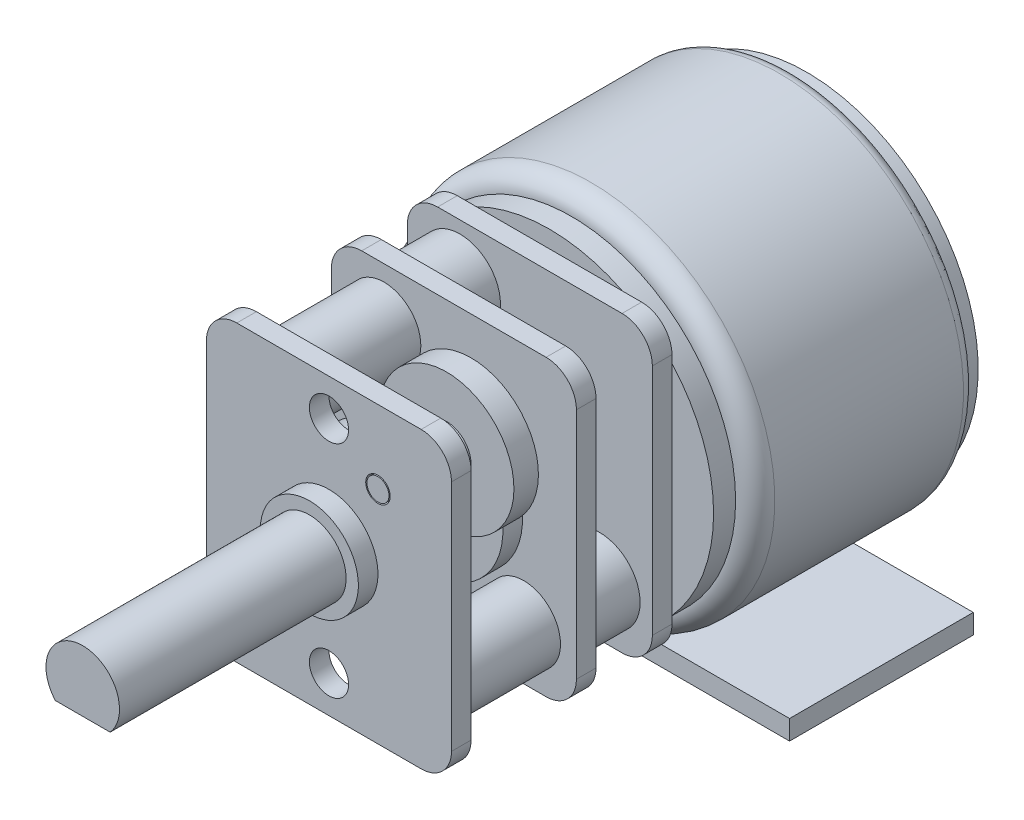
from build123d import *

# Parameters (mm, degrees)
SKETCH_2_OUTSIDE_W           = 24.52
SKETCH_2_OUTSIDE_H           = 24.52
CUT_EXTRUDE_1539_DEPTH       = 6.5
EXTRUDE_5_DEPTH              = 0.8
EXTRUDE_START                = 0.8
SKETCH_8_R                   = 0.8
SKETCH_8_R_2                 = 0.5
EXTRUDE_6_DEPTH              = 0.8
SKETCH_9_R                   = 1.65
EXTRUDE_7_DEPTH              = 2.3
EXTRUDE_8_DEPTH              = 0.8
EXTRUDE_9_REACH              = 21.113
SKETCH_11_R                  = 1.5
SKETCH_4_W                   = 11.5
SKETCH_4_H                   = 7.5
EXTRUDE_4966_DEPTH           = 0.8
SKETCH_5005_R                = 0.75
EXTRUDE_5453_DEPTH           = 0.7
EXTRUDE_5453_DRAFT           = 35
EXTRUDE_5453_PROFILE_2_DEPTH = 0.7
EXTRUDE_5453_PROFILE_2_DRAFT = 35
EXTRUDE_5453_PROFILE_3_DEPTH = 0.7
EXTRUDE_5453_PROFILE_3_DRAFT = 35
EXTRUDE_5453_PROFILE_4_DEPTH = 0.7
EXTRUDE_5453_PROFILE_4_DRAFT = 35
EXTRUDE_5453_PROFILE_5_DEPTH = 0.7
EXTRUDE_5453_PROFILE_5_DRAFT = 35
EXTRUDE_5453_PROFILE_6_DEPTH = 0.7
EXTRUDE_5453_PROFILE_6_DRAFT = 35
EXTRUDE_5453_PROFILE_7_DEPTH = 0.7
EXTRUDE_5453_PROFILE_7_DRAFT = 35
EXTRUDE_5453_PROFILE_8_DEPTH = 0.7
EXTRUDE_5453_PROFILE_8_DRAFT = 35
EXTRUDE_5762_DEPTH           = 0.01


with BuildPart() as part:
    # Эскиз1 → Motor (revolve)
    with BuildSketch(Plane(origin=(0, 0, 0), x_dir=(1, 0, 0), z_dir=(0, 1, 0))):
        with BuildLine():
            Line((0, 0), (-0.5, 0))
            ThreePointArc((-0.5, 0), (-0.676776695, -0.073223305), (-0.75, -0.25))
            Line((-0.75, -0.25), (-0.75, -0.5))
            Line((-0.75, -0.5), (-3, -0.5))
            Line((-3, -0.5), (-3, -1.5))
            Line((-3, -1.5), (-7, -1.5))
            Line((-7, -1.5), (-7, -2.1))
            ThreePointArc((-7, -2.1), (-7.353553391, -2.246446609), (-7.5, -2.6))
            Line((-7.5, -2.6), (-7.5, -10.3))
            ThreePointArc((-7.5, -10.3), (-7.265685425, -10.865685425), (-6.7, -11.1))
            Line((-6.7, -11.1), (-6.7, -12))
            Line((-6.7, -12), (-0.75, -12))
            Line((-0.75, -12), (0, -12))
            Line((0, -12), (0, 0))
        make_face()
        Polygon((0, -21), (-2, -21), (-2, -21.8), (-1.5, -21.8), (-1.5, -31.05), (0, -31.05), align=None)
    revolve(axis=Axis((0, 0, 0), (0, 0, 1)))

    # Эскиз2 outside → Cut-Extrude 1539 (cut)
    with BuildSketch(Plane.XY.offset(31.05)):
        Rectangle(SKETCH_2_OUTSIDE_W, SKETCH_2_OUTSIDE_H)
        with BuildLine():
            Line((-1.118033989, -1), (1.118033989, -1))
            ThreePointArc((1.118033989, -1), (0, 1.5), (-1.118033989, -1))
        make_face(mode=Mode.SUBTRACT)
    extrude(amount=-CUT_EXTRUDE_1539_DEPTH, mode=Mode.SUBTRACT)

    # Эскиз7 → Бобышка-Вытянуть5 (add)
    with BuildSketch(Plane.XY.offset(12)):
        with BuildLine():
            Line((3.762711015, 6), (-3.762711015, 6))
            ThreePointArc((-3.762711015, 6), (-4.637606447, 5.637606447), (-5, 4.762711015))
            Line((-5, 4.762711015), (-5, -4.762711015))
            ThreePointArc((-5, -4.762711015), (-4.637606447, -5.637606447), (-3.762711015, -6))
            Line((-3.762711015, -6), (3.762711015, -6))
            ThreePointArc((3.762711015, -6), (4.637606447, -5.637606447), (5, -4.762711015))
            Line((5, -4.762711015), (5, 4.762711015))
            ThreePointArc((5, 4.762711015), (4.637606447, 5.637606447), (3.762711015, 6))
        make_face()
    extrude(amount=EXTRUDE_5_DEPTH)

    # Эскиз8 → Бобышка-Вытянуть6 (add)
    with BuildSketch(Plane(origin=(0, 0, 21), x_dir=(-1, 0, 0), z_dir=(0, 0, -1)).offset(EXTRUDE_START)):
        with BuildLine():
            Line((3.762711015, 6), (-3.762711015, 6))
            ThreePointArc((-3.762711015, 6), (-4.637606447, 5.637606447), (-5, 4.762711015))
            Line((-5, 4.762711015), (-5, -4.762711015))
            ThreePointArc((-5, -4.762711015), (-4.637606447, -5.637606447), (-3.762711015, -6))
            Line((-3.762711015, -6), (3.762711015, -6))
            ThreePointArc((3.762711015, -6), (4.637606447, -5.637606447), (5, -4.762711015))
            Line((5, -4.762711015), (5, 4.762711015))
            ThreePointArc((5, 4.762711015), (4.637606447, 5.637606447), (3.762711015, 6))
        make_face()
        with Locations((0, -4.5)):
            Circle(SKETCH_8_R, mode=Mode.SUBTRACT)
        with Locations((0, 4.5)):
            Circle(SKETCH_8_R, mode=Mode.SUBTRACT)
        with Locations((2, -3)):
            Circle(SKETCH_8_R_2, mode=Mode.SUBTRACT)
        with Locations((-2, 3)):
            Circle(SKETCH_8_R_2, mode=Mode.SUBTRACT)
    extrude(amount=-EXTRUDE_6_DEPTH)

    # Эскиз9 → Бобышка-Вытянуть7 (add)
    with BuildSketch(Plane.XY.offset(12.8)):
        with Locations((2.85, -3.85)):
            Circle(SKETCH_9_R)
        with Locations((-2.85, 3.85)):
            Circle(SKETCH_9_R)
    extrude(amount=EXTRUDE_7_DEPTH)

    # Эскиз10 → Бобышка-Вытянуть8 (add)
    with BuildSketch(Plane.XY.offset(15.1)):
        with BuildLine():
            Line((3.762711015, 6), (-3.762711015, 6))
            ThreePointArc((-3.762711015, 6), (-4.637606447, 5.637606447), (-5, 4.762711015))
            Line((-5, 4.762711015), (-5, -0.262711015))
            ThreePointArc((-5, -0.262711015), (-4.637606447, -1.137606447), (-3.762711015, -1.5))
            Line((-3.762711015, -1.5), (-1.237288985, -1.5))
            ThreePointArc((-1.237288985, -1.5), (-0.362393553, -1.862393553), (0, -2.737288985))
            Line((0, -2.737288985), (0, -4.762711015))
            ThreePointArc((0, -4.762711015), (0.362393553, -5.637606447), (1.237288985, -6))
            Line((1.237288985, -6), (3.762711015, -6))
            ThreePointArc((3.762711015, -6), (4.637606447, -5.637606447), (5, -4.762711015))
            Line((5, -4.762711015), (5, 4.762711015))
            ThreePointArc((5, 4.762711015), (4.637606447, 5.637606447), (3.762711015, 6))
        make_face()
    extrude(amount=EXTRUDE_8_DEPTH)

    # Эскиз11 → Бобышка-Вытянуть9 (add, up to next)
    with BuildSketch(Plane.XY.offset(15.9), mode=Mode.PRIVATE) as extrude_9_sk1:
        with Locations((2.85, -3.85)):
            Circle(SKETCH_11_R)
    extrude_9_tool1 = extrude(extrude_9_sk1.sketch, amount=EXTRUDE_9_REACH, mode=Mode.PRIVATE) - part.part
    # Эскиз11 → Бобышка-Вытянуть9 (add, up to next)
    with BuildSketch(Plane.XY.offset(15.9), mode=Mode.PRIVATE) as extrude_9_sk2:
        with Locations((-2.85, 3.85)):
            Circle(SKETCH_11_R)
    extrude_9_tool2 = extrude(extrude_9_sk2.sketch, amount=EXTRUDE_9_REACH, mode=Mode.PRIVATE) - part.part
    add(extrude_9_tool1.solids().sort_by_distance((2.85, -3.85, 15.9))[0])
    add(extrude_9_tool2.solids().sort_by_distance((-2.85, 3.85, 15.9))[0])

    # Эскиз12 → Повернуть1 (revolve)
    with BuildSketch(Plane(origin=(0, 0, 0), x_dir=(1, 0, 0), z_dir=(0, 1, 0))):
        Polygon((0, -20.2), (-0.5, -20.2), (-0.5, -20), (-3, -20), (-3, -18.6), (-0.5, -18.6), (-0.5, -18.3), (-1.5, -18.3), (-1.5, -16.9), (-3, -16.9), (-3, -16.1), (-0.5, -16.1), (-0.5, -15.9), (0, -15.9), align=None)
        with BuildLine():
            Line((0, -12.8), (-0.75, -12.8))
            Line((-0.75, -12.8), (-0.75, -13))
            Line((-0.75, -13), (-1.5, -13))
            Line((-1.5, -13), (-1.5, -14))
            Line((-1.5, -14), (-0.75, -14))
            Line((-0.75, -14), (-0.75, -14.15))
            ThreePointArc((-0.75, -14.15), (-0.676776695, -14.326776695), (-0.5, -14.4))
            Line((-0.5, -14.4), (0, -14.4))
            Line((0, -14.4), (0, -12.8))
        make_face()
    revolve(axis=Axis((0, 0, 20.2), (0, 0, -1)))

    # Эскиз13 → Повернуть2 (revolve)
    with BuildSketch(Plane(origin=(0, 0, 0), x_dir=(0, 0, 1), z_dir=(-0.8320502943378438, 0.5547001962252291, 0))):
        Polygon((21, -3.605551275), (12.8, -3.605551275), (12.8, -3.304954271), (13, -3.304954271), (13, -0.855551275), (14, -0.855551275), (14, -2.605551275), (17.3, -2.605551275), (17.3, -3.155551275), (21, -3.155551275), align=None)
    revolve(axis=Axis((-2, -3, 21), (0, 0, 1)))

    # Эскиз14 → Повернуть3 (revolve)
    with BuildSketch(Plane(origin=(0, 0, 0), x_dir=(0, 0, 1), z_dir=(-0.8320502943378438, 0.5547001962252291, 0))):
        Polygon((21, 3.605551275), (15.9, 3.605551275), (15.9, 3.105551275), (17.2, 3.105551275), (17.2, 0.855551275), (18.2, 0.855551275), (18.2, 2.605551275), (20, 2.605551275), (20, 3.155551275), (21, 3.155551275), align=None)
    revolve(axis=Axis((2, 3, 21), (0, 0, 1)))


with BuildPart() as body_2:
    # Эскиз4 → Extrude 4966 (new body)
    with BuildSketch(Plane(origin=(0, -7.5, 0), x_dir=(-1, 0, 0), z_dir=(0, -1, 0))):
        with Locations((-2.25, -6.45)):
            Rectangle(SKETCH_4_W, SKETCH_4_H)
    extrude(amount=EXTRUDE_4966_DEPTH)


with BuildPart() as extrude_5453_tool:
    # Sketch 5005 → Extrude 5453 (with draft: the straight prism first)
    with BuildSketch(Plane.XZ.offset(8.3)):
        with Locations((-2.25, 5.7)):
            Circle(SKETCH_5005_R)
    extrude(amount=EXTRUDE_5453_DEPTH)
    # Extrude 5453: the draft: its side faces are tilted about the plane it starts from
    extrude_5453_sides = [extrude_5453_tool.faces().sort_by_distance(p)[0] for p in [
        (-3, -8.65, 5.7),
    ]]
    draft(extrude_5453_sides, Plane.XZ.offset(8.3), EXTRUDE_5453_DRAFT)


with BuildPart() as body_2_1:
    add(body_2.part)

    # Extrude 5453: add extrude_5453_tool
    add(extrude_5453_tool.part)


with BuildPart() as extrude_5453_profile_2_tool:
    # Sketch 5005 → Extrude 5453 profile 2 (with draft: the straight prism first)
    with BuildSketch(Plane.XZ.offset(8.3)):
        with Locations((-0.75, 7.2)):
            Circle(SKETCH_5005_R)
    extrude(amount=EXTRUDE_5453_PROFILE_2_DEPTH)
    # Extrude 5453 profile 2: the draft: its side faces are tilted about the plane it starts from
    extrude_5453_profile_2_sides = [extrude_5453_profile_2_tool.faces().sort_by_distance(p)[0] for p in [
        (-1.5, -8.65, 7.2),
    ]]
    draft(extrude_5453_profile_2_sides, Plane.XZ.offset(8.3), EXTRUDE_5453_PROFILE_2_DRAFT)


with BuildPart() as body_2_2:
    add(body_2_1.part)

    # Extrude 5453 profile 2: add extrude_5453_profile_2_tool
    add(extrude_5453_profile_2_tool.part)


with BuildPart() as extrude_5453_profile_3_tool:
    # Sketch 5005 → Extrude 5453 profile 3 (with draft: the straight prism first)
    with BuildSketch(Plane.XZ.offset(8.3)):
        with Locations((0.75, 5.7)):
            Circle(SKETCH_5005_R)
    extrude(amount=EXTRUDE_5453_PROFILE_3_DEPTH)
    # Extrude 5453 profile 3: the draft: its side faces are tilted about the plane it starts from
    extrude_5453_profile_3_sides = [extrude_5453_profile_3_tool.faces().sort_by_distance(p)[0] for p in [
        (0, -8.65, 5.7),
    ]]
    draft(extrude_5453_profile_3_sides, Plane.XZ.offset(8.3), EXTRUDE_5453_PROFILE_3_DRAFT)


with BuildPart() as body_2_3:
    add(body_2_2.part)

    # Extrude 5453 profile 3: add extrude_5453_profile_3_tool
    add(extrude_5453_profile_3_tool.part)


with BuildPart() as extrude_5453_profile_4_tool:
    # Sketch 5005 → Extrude 5453 profile 4 (with draft: the straight prism first)
    with BuildSketch(Plane.XZ.offset(8.3)):
        with Locations((2.25, 7.2)):
            Circle(SKETCH_5005_R)
    extrude(amount=EXTRUDE_5453_PROFILE_4_DEPTH)
    # Extrude 5453 profile 4: the draft: its side faces are tilted about the plane it starts from
    extrude_5453_profile_4_sides = [extrude_5453_profile_4_tool.faces().sort_by_distance(p)[0] for p in [
        (1.5, -8.65, 7.2),
    ]]
    draft(extrude_5453_profile_4_sides, Plane.XZ.offset(8.3), EXTRUDE_5453_PROFILE_4_DRAFT)


with BuildPart() as body_2_4:
    add(body_2_3.part)

    # Extrude 5453 profile 4: add extrude_5453_profile_4_tool
    add(extrude_5453_profile_4_tool.part)


with BuildPart() as extrude_5453_profile_5_tool:
    # Sketch 5005 → Extrude 5453 profile 5 (with draft: the straight prism first)
    with BuildSketch(Plane.XZ.offset(8.3)):
        with Locations((7, 3.7)):
            Circle(SKETCH_5005_R)
    extrude(amount=EXTRUDE_5453_PROFILE_5_DEPTH)
    # Extrude 5453 profile 5: the draft: its side faces are tilted about the plane it starts from
    extrude_5453_profile_5_sides = [extrude_5453_profile_5_tool.faces().sort_by_distance(p)[0] for p in [
        (6.25, -8.65, 3.7),
    ]]
    draft(extrude_5453_profile_5_sides, Plane.XZ.offset(8.3), EXTRUDE_5453_PROFILE_5_DRAFT)


with BuildPart() as body_2_5:
    add(body_2_4.part)

    # Extrude 5453 profile 5: add extrude_5453_profile_5_tool
    add(extrude_5453_profile_5_tool.part)


with BuildPart() as extrude_5453_profile_6_tool:
    # Sketch 5005 → Extrude 5453 profile 6 (with draft: the straight prism first)
    with BuildSketch(Plane.XZ.offset(8.3)):
        with Locations((7, 5.533333333)):
            Circle(SKETCH_5005_R)
    extrude(amount=EXTRUDE_5453_PROFILE_6_DEPTH)
    # Extrude 5453 profile 6: the draft: its side faces are tilted about the plane it starts from
    extrude_5453_profile_6_sides = [extrude_5453_profile_6_tool.faces().sort_by_distance(p)[0] for p in [
        (6.25, -8.65, 5.533333333),
    ]]
    draft(extrude_5453_profile_6_sides, Plane.XZ.offset(8.3), EXTRUDE_5453_PROFILE_6_DRAFT)


with BuildPart() as body_2_6:
    add(body_2_5.part)

    # Extrude 5453 profile 6: add extrude_5453_profile_6_tool
    add(extrude_5453_profile_6_tool.part)


with BuildPart() as extrude_5453_profile_7_tool:
    # Sketch 5005 → Extrude 5453 profile 7 (with draft: the straight prism first)
    with BuildSketch(Plane.XZ.offset(8.3)):
        with Locations((7, 7.366666667)):
            Circle(SKETCH_5005_R)
    extrude(amount=EXTRUDE_5453_PROFILE_7_DEPTH)
    # Extrude 5453 profile 7: the draft: its side faces are tilted about the plane it starts from
    extrude_5453_profile_7_sides = [extrude_5453_profile_7_tool.faces().sort_by_distance(p)[0] for p in [
        (6.25, -8.65, 7.366666667),
    ]]
    draft(extrude_5453_profile_7_sides, Plane.XZ.offset(8.3), EXTRUDE_5453_PROFILE_7_DRAFT)


with BuildPart() as body_2_7:
    add(body_2_6.part)

    # Extrude 5453 profile 7: add extrude_5453_profile_7_tool
    add(extrude_5453_profile_7_tool.part)


with BuildPart() as extrude_5453_profile_8_tool:
    # Sketch 5005 → Extrude 5453 profile 8 (with draft: the straight prism first)
    with BuildSketch(Plane.XZ.offset(8.3)):
        with Locations((7, 9.2)):
            Circle(SKETCH_5005_R)
    extrude(amount=EXTRUDE_5453_PROFILE_8_DEPTH)
    # Extrude 5453 profile 8: the draft: its side faces are tilted about the plane it starts from
    extrude_5453_profile_8_sides = [extrude_5453_profile_8_tool.faces().sort_by_distance(p)[0] for p in [
        (6.25, -8.65, 9.2),
    ]]
    draft(extrude_5453_profile_8_sides, Plane.XZ.offset(8.3), EXTRUDE_5453_PROFILE_8_DRAFT)


with BuildPart() as body_2_8:
    add(body_2_7.part)

    # Extrude 5453 profile 8: add extrude_5453_profile_8_tool
    add(extrude_5453_profile_8_tool.part)

    # Эскиз6 → Extrude 5762 (add)
    # profile 1 of 16: a face of its own
    with BuildSketch(Plane.XZ.offset(8.3)):
        with BuildLine():
            Line((5.183226347, 9.305128205), (5.183226347, 9.228846154))
            add(Edge.make_bspline(
                [(5.183226347, 9.228846154), (5.173106274, 9.22934332), (5.153230721, 9.23031974), (5.124252058, 9.234892324), (5.096553035, 9.241435109), (5.070356056, 9.250685891), (5.045429488, 9.262174558), (5.021872342, 9.27595185), (4.999774482, 9.292270357), (4.979340763, 9.310777707), (4.96059521, 9.330878662), (4.944407508, 9.352567247), (4.930730359, 9.375358182), (4.919296343, 9.399182322), (4.910713809, 9.424308459), (4.904345697, 9.450508582), (4.900514298, 9.4778978), (4.900102465, 9.496558949), (4.899893013, 9.506049679)],
                knots=[0, 0, 0, 0, 1.10065271, 2.161652631, 3.183658789, 4.190468796, 5.17591951, 6.163126047, 7.15150782, 8.156236427, 9.156009102, 10.134482811, 11.092018607, 12.041330605, 13.001268258, 13.972401359, 14.968799086, 16, 16, 16, 16], degree=3))
            add(Edge.make_bspline(
                [(4.899893013, 9.506049679), (4.900109439, 9.515370725), (4.900534708, 9.533686246), (4.904241722, 9.560406313), (4.909922389, 9.585903666), (4.918340243, 9.609889343), (4.928902809, 9.632609504), (4.942038744, 9.653782836), (4.957126498, 9.673921332), (4.974923245, 9.69203663), (4.993912419, 9.708677717), (5.014192696, 9.723021328), (5.035163128, 9.735374158), (5.056987523, 9.745484564), (5.079736952, 9.753148701), (5.10319331, 9.758827092), (5.127627297, 9.762073168), (5.144167936, 9.762568621), (5.152577308, 9.762820513)],
                knots=[0, 0, 0, 0, 1.111674182, 2.184400057, 3.212814286, 4.223731311, 5.211378316, 6.196328225, 7.191884489, 8.207283132, 9.220262353, 10.201199469, 11.166417575, 12.120932471, 13.06540007, 14.026332106, 14.996573967, 16, 16, 16, 16], degree=3))
            add(Edge.make_bspline(
                [(5.152577308, 9.762820513), (5.164416063, 9.762409285), (5.187885819, 9.761594047), (5.222375218, 9.75462065), (5.255790478, 9.743728994), (5.282684739, 9.730616512), (5.304353679, 9.717384889), (5.322203622, 9.705473201), (5.341418154, 9.691449296), (5.362075046, 9.675432988), (5.383903778, 9.657148454), (5.407349714, 9.637070722), (5.431979324, 9.614681279), (5.448812639, 9.598980897), (5.457535241, 9.590845353)],
                knots=[0, 0, 0, 0, 1.184416499, 2.348048165, 3.509039915, 4.696071444, 5.333504901, 6.05069495, 6.844171097, 7.714965912, 8.667477798, 9.695072654, 10.805644396, 12, 12, 12, 12], degree=3))
            Line((5.457535241, 9.590845353), (5.684508398, 9.37817508))
            Line((5.684508398, 9.37817508), (5.684508398, 9.773717949))
            Line((5.684508398, 9.773717949), (5.771687885, 9.773717949))
            Line((5.771687885, 9.773717949), (5.771687885, 9.196153846))
            Line((5.771687885, 9.196153846), (5.419905033, 9.525801282))
            add(Edge.make_bspline(
                [(5.419905033, 9.525801282), (5.411526873, 9.533827197), (5.395434141, 9.549243338), (5.371939423, 9.571047678), (5.350143106, 9.590631433), (5.330086372, 9.608121371), (5.311475849, 9.623138079), (5.294914278, 9.636464193), (5.279673911, 9.647141551), (5.262008334, 9.658729575), (5.240439628, 9.669952971), (5.214081446, 9.6795974), (5.186947685, 9.685478149), (5.168611476, 9.686183609), (5.159388206, 9.686538462)],
                knots=[0, 0, 0, 0, 1.329631726, 2.553950428, 3.673215718, 4.687767853, 5.603093632, 6.413772471, 7.123043292, 7.734684054, 8.834405432, 9.900288307, 10.943827018, 12, 12, 12, 12], degree=3))
            add(Edge.make_bspline(
                [(5.159388206, 9.686538462), (5.153588438, 9.686384067), (5.142158208, 9.686079785), (5.125399667, 9.683394344), (5.109233926, 9.679336078), (5.093611262, 9.673520801), (5.078688746, 9.665844879), (5.064448215, 9.656501344), (5.050680895, 9.6457209), (5.037772237, 9.633249877), (5.025949658, 9.619549937), (5.015476666, 9.605077047), (5.006724311, 9.589764879), (4.999549462, 9.573677992), (4.993921155, 9.556861236), (4.990021214, 9.539282083), (4.987572611, 9.520989108), (4.987241312, 9.508498116), (4.987072501, 9.502133413)],
                knots=[0, 0, 0, 0, 0.991446411, 1.95395049, 2.89581595, 3.838931463, 4.798493298, 5.75982156, 6.748411868, 7.785213223, 8.824556874, 9.840280684, 10.836137867, 11.835679398, 12.848801643, 13.863922112, 14.911575587, 16, 16, 16, 16], degree=3))
            add(Edge.make_bspline(
                [(4.987072501, 9.502133413), (4.987239299, 9.495484543), (4.987566864, 9.482427259), (4.990048006, 9.463296967), (4.993809418, 9.444921487), (4.999783361, 9.427574998), (5.006841872, 9.410881872), (5.015808949, 9.395198482), (5.026228891, 9.380264435), (5.03831124, 9.366325367), (5.051886632, 9.353594562), (5.066847651, 9.342251598), (5.08308659, 9.332405907), (5.1005368, 9.323803635), (5.119372022, 9.316820921), (5.139521114, 9.311484355), (5.160897794, 9.307261899), (5.175659878, 9.305851249), (5.183226347, 9.305128205)],
                knots=[0, 0, 0, 0, 1.030878251, 2.024474673, 2.987898669, 3.934362936, 4.864849709, 5.795128259, 6.730474222, 7.685293701, 8.650606017, 9.611896181, 10.591709709, 11.591680886, 12.625074257, 13.701333388, 14.821793024, 16, 16, 16, 16], degree=3))
        make_face()
    # profile 2 of 16: a face of its own
    with BuildSketch(Plane.XZ.offset(8.3)):
        Polygon((4.921687885, 8.749358974), (5.771687885, 9.141666667), (5.771687885, 9.05874399), (5.499251988, 8.933082933), (5.499251988, 8.54775641), (5.771687885, 8.418519631), (5.771687885, 8.33525641), (4.921687885, 8.738461538), align=None)
        Polygon((5.087362965, 8.743058894), (5.412072501, 8.589132612), (5.412072501, 8.892898638), align=None, mode=Mode.SUBTRACT)
    # profile 3 of 16: a face of its own
    with BuildSketch(Plane.XZ.offset(8.3)):
        Polygon((4.921687885, 7.524248798), (4.921687885, 7.681410256), (5.771687885, 7.681410256), (5.771687885, 7.605128205), (5.008867372, 7.605128205), (5.008867372, 7.474358974), align=None)
    # profile 4 of 16: a face of its own
    with BuildSketch(Plane.XZ.offset(8.3)):
        Polygon((4.921687885, 6.896794872), (5.771687885, 7.289102564), (5.771687885, 7.206179888), (5.499251988, 7.08051883), (5.499251988, 6.695192308), (5.771687885, 6.565955529), (5.771687885, 6.482692308), (4.921687885, 6.885897436), align=None)
        Polygon((5.087362965, 6.890494792), (5.412072501, 6.73656851), (5.412072501, 7.040334535), align=None, mode=Mode.SUBTRACT)
    # profile 5 of 16: a face of its own
    with BuildSketch(Plane.XZ.offset(8.3)):
        with BuildLine():
            Line((5.183226347, 5.6), (5.183226347, 5.523717949))
            add(Edge.make_bspline(
                [(5.183226347, 5.523717949), (5.173106274, 5.524215114), (5.153230721, 5.525191535), (5.124252058, 5.529764119), (5.096553035, 5.536306904), (5.070356056, 5.545557685), (5.045429488, 5.557046353), (5.021872342, 5.570823645), (4.999774482, 5.587142152), (4.979340763, 5.605649501), (4.96059521, 5.625750457), (4.944407508, 5.647439042), (4.930730359, 5.670229977), (4.919296343, 5.694054117), (4.910713809, 5.719180254), (4.904345697, 5.745380376), (4.900514298, 5.772769595), (4.900102465, 5.791430743), (4.899893013, 5.800921474)],
                knots=[0, 0, 0, 0, 1.10065271, 2.161652631, 3.183658789, 4.190468796, 5.17591951, 6.163126047, 7.15150782, 8.156236427, 9.156009102, 10.134482811, 11.092018607, 12.041330605, 13.001268258, 13.972401359, 14.968799086, 16, 16, 16, 16], degree=3))
            add(Edge.make_bspline(
                [(4.899893013, 5.800921474), (4.900109439, 5.81024252), (4.900534708, 5.828558041), (4.904241722, 5.855278108), (4.909922389, 5.880775461), (4.918340243, 5.904761137), (4.928902809, 5.927481298), (4.942038744, 5.94865463), (4.957126498, 5.968793127), (4.974923245, 5.986908425), (4.993912419, 6.003549512), (5.014192696, 6.017893123), (5.035163128, 6.030245953), (5.056987523, 6.040356359), (5.079736952, 6.048020496), (5.10319331, 6.053698887), (5.127627297, 6.056944963), (5.144167936, 6.057440416), (5.152577308, 6.057692308)],
                knots=[0, 0, 0, 0, 1.111674182, 2.184400057, 3.212814286, 4.223731311, 5.211378316, 6.196328225, 7.191884489, 8.207283132, 9.220262353, 10.201199469, 11.166417575, 12.120932471, 13.06540007, 14.026332106, 14.996573967, 16, 16, 16, 16], degree=3))
            add(Edge.make_bspline(
                [(5.152577308, 6.057692308), (5.164416063, 6.05728108), (5.187885819, 6.056465842), (5.222375218, 6.049492445), (5.255790478, 6.038600789), (5.282684739, 6.025488307), (5.304353679, 6.012256684), (5.322203622, 6.000344996), (5.341418154, 5.986321091), (5.362075046, 5.970304783), (5.383903778, 5.952020248), (5.407349714, 5.931942517), (5.431979324, 5.909553074), (5.448812639, 5.893852692), (5.457535241, 5.885717147)],
                knots=[0, 0, 0, 0, 1.184416499, 2.348048165, 3.509039915, 4.696071444, 5.333504901, 6.05069495, 6.844171097, 7.714965912, 8.667477798, 9.695072654, 10.805644396, 12, 12, 12, 12], degree=3))
            Line((5.457535241, 5.885717147), (5.684508398, 5.673046875))
            Line((5.684508398, 5.673046875), (5.684508398, 6.068589744))
            Line((5.684508398, 6.068589744), (5.771687885, 6.068589744))
            Line((5.771687885, 6.068589744), (5.771687885, 5.491025641))
            Line((5.771687885, 5.491025641), (5.419905033, 5.820673077))
            add(Edge.make_bspline(
                [(5.419905033, 5.820673077), (5.411526873, 5.828698992), (5.395434141, 5.844115133), (5.371939423, 5.865919473), (5.350143106, 5.885503228), (5.330086372, 5.902993166), (5.311475849, 5.918009874), (5.294914278, 5.931335988), (5.279673911, 5.942013346), (5.262008334, 5.95360137), (5.240439628, 5.964824766), (5.214081446, 5.974469195), (5.186947685, 5.980349944), (5.168611476, 5.981055404), (5.159388206, 5.981410256)],
                knots=[0, 0, 0, 0, 1.329631726, 2.553950428, 3.673215718, 4.687767853, 5.603093632, 6.413772471, 7.123043292, 7.734684054, 8.834405432, 9.900288307, 10.943827018, 12, 12, 12, 12], degree=3))
            add(Edge.make_bspline(
                [(5.159388206, 5.981410256), (5.153588438, 5.981255862), (5.142158208, 5.98095158), (5.125399667, 5.978266139), (5.109233926, 5.974207873), (5.093611262, 5.968392596), (5.078688746, 5.960716674), (5.064448215, 5.951373139), (5.050680895, 5.940592695), (5.037772237, 5.928121672), (5.025949658, 5.914421732), (5.015476666, 5.899948842), (5.006724311, 5.884636674), (4.999549462, 5.868549787), (4.993921155, 5.85173303), (4.990021214, 5.834153878), (4.987572611, 5.815860903), (4.987241312, 5.803369911), (4.987072501, 5.797005208)],
                knots=[0, 0, 0, 0, 0.991446411, 1.95395049, 2.89581595, 3.838931463, 4.798493298, 5.75982156, 6.748411868, 7.785213223, 8.824556874, 9.840280684, 10.836137867, 11.835679398, 12.848801643, 13.863922112, 14.911575587, 16, 16, 16, 16], degree=3))
            add(Edge.make_bspline(
                [(4.987072501, 5.797005208), (4.987239299, 5.790356338), (4.987566864, 5.777299054), (4.990048006, 5.758168762), (4.993809418, 5.739793282), (4.999783361, 5.722446793), (5.006841872, 5.705753667), (5.015808949, 5.690070277), (5.026228891, 5.67513623), (5.03831124, 5.661197162), (5.051886632, 5.648466356), (5.066847651, 5.637123393), (5.08308659, 5.627277702), (5.1005368, 5.61867543), (5.119372022, 5.611692716), (5.139521114, 5.606356149), (5.160897794, 5.602133694), (5.175659878, 5.600723044), (5.183226347, 5.6)],
                knots=[0, 0, 0, 0, 1.030878251, 2.024474673, 2.987898669, 3.934362936, 4.864849709, 5.795128259, 6.730474222, 7.685293701, 8.650606017, 9.611896181, 10.591709709, 11.591680886, 12.625074257, 13.701333388, 14.821793024, 16, 16, 16, 16], degree=3))
        make_face()
    # profile 6 of 16: a face of its own
    with BuildSketch(Plane.XZ.offset(8.3)):
        with BuildLine():
            Line((4.921687885, 4.891666667), (4.921687885, 5.057512019))
            add(Edge.make_bspline(
                [(4.921687885, 5.057512019), (4.921729896, 5.065630492), (4.921811322, 5.081366113), (4.9231035, 5.104246237), (4.924821328, 5.125684119), (4.927702893, 5.145641874), (4.930690696, 5.164249365), (4.935076075, 5.181317687), (4.939919886, 5.196989808), (4.947372746, 5.215808817), (4.958947132, 5.237161562), (4.976113047, 5.260111768), (4.996693592, 5.280061486), (5.020146747, 5.297024661), (5.045947875, 5.310637969), (5.073541857, 5.320362002), (5.102464456, 5.326609091), (5.122293572, 5.327243488), (5.132314888, 5.327564103)],
                knots=[0, 0, 0, 0, 1.00128172, 1.940733171, 2.826250472, 3.653024905, 4.427672124, 5.149348099, 5.824709082, 6.450061444, 7.643590664, 8.808605388, 9.972104426, 11.165284501, 12.367876273, 13.557044126, 14.765369432, 16, 16, 16, 16], degree=3))
            add(Edge.make_bspline(
                [(5.132314888, 5.327564103), (5.141701525, 5.327297054), (5.160147151, 5.326772279), (5.187079484, 5.321815329), (5.212690558, 5.313947941), (5.236958454, 5.303074894), (5.259431423, 5.28906558), (5.28003985, 5.272280453), (5.29800485, 5.252113258), (5.308044519, 5.23699586), (5.313144215, 5.229316907)],
                knots=[0, 0, 0, 0, 1.044641374, 2.052818814, 3.038628718, 4.023282556, 5.005660861, 5.98021751, 6.974042014, 8, 8, 8, 8], degree=3))
            add(Edge.make_bspline(
                [(5.313144215, 5.229316907), (5.31685263, 5.238972078), (5.323947745, 5.257444813), (5.336472213, 5.282880656), (5.350143866, 5.304715331), (5.364843335, 5.323375369), (5.380921481, 5.33925023), (5.39850893, 5.352998779), (5.417591286, 5.364884666), (5.438098413, 5.374999475), (5.459856464, 5.382944783), (5.482599686, 5.388784474), (5.506240892, 5.392238779), (5.522284288, 5.392709999), (5.530411844, 5.392948718)],
                knots=[0, 0, 0, 0, 1.272586185, 2.434772614, 3.483318042, 4.437947805, 5.351807173, 6.25737843, 7.180033415, 8.1141739, 9.066731021, 10.025721652, 10.999834114, 12, 12, 12, 12], degree=3))
            add(Edge.make_bspline(
                [(5.530411844, 5.392948718), (5.538709546, 5.392711536), (5.555035509, 5.392244873), (5.579018416, 5.388800425), (5.601939819, 5.382972364), (5.623937413, 5.374930785), (5.644965078, 5.36450756), (5.664946637, 5.351639506), (5.683923663, 5.336507263), (5.701929646, 5.319405383), (5.718405686, 5.300346676), (5.732569525, 5.279342753), (5.744748407, 5.256969021), (5.754664019, 5.232939453), (5.762313907, 5.20731539), (5.767643775, 5.180111092), (5.771241058, 5.151371361), (5.771536416, 5.131648848), (5.771687885, 5.121534455)],
                knots=[0, 0, 0, 0, 0.978680899, 1.925582087, 2.851223405, 3.764209995, 4.683484765, 5.614004905, 6.562443559, 7.542772147, 8.539900013, 9.527881485, 10.525548727, 11.540192123, 12.58875426, 13.674701727, 14.807505862, 16, 16, 16, 16], degree=3))
            Line((5.771687885, 5.121534455), (5.771687885, 4.891666667))
            Line((5.771687885, 4.891666667), (4.921687885, 4.891666667))
        make_face()
        with BuildLine():
            Line((5.008867372, 4.967948718), (5.28130327, 4.967948718))
            Line((5.28130327, 4.967948718), (5.28130327, 5.019200721))
            add(Edge.make_bspline(
                [(5.28130327, 5.019200721), (5.281206146, 5.026692571), (5.281018482, 5.041168353), (5.280480913, 5.062131756), (5.278975675, 5.08159069), (5.277470866, 5.099511561), (5.275024188, 5.115866163), (5.272111792, 5.130618217), (5.269031732, 5.14399939), (5.263793117, 5.159430062), (5.256053503, 5.176935943), (5.244030592, 5.195585728), (5.22972181, 5.212103369), (5.213057021, 5.225884323), (5.194906136, 5.237262557), (5.175428501, 5.245233368), (5.155016081, 5.250547271), (5.140975869, 5.251034615), (5.13384734, 5.251282051)],
                knots=[0, 0, 0, 0, 1.156917035, 2.235399477, 3.236897345, 4.169954739, 5.01148057, 5.788325709, 6.491867502, 7.129259015, 8.302032419, 9.437271567, 10.542795419, 11.662606952, 12.764338259, 13.836858145, 14.901724648, 16, 16, 16, 16], degree=3))
            add(Edge.make_bspline(
                [(5.13384734, 5.251282051), (5.129129035, 5.251156419), (5.119873562, 5.250909976), (5.106337387, 5.248818291), (5.093618347, 5.245429205), (5.081594372, 5.240839469), (5.070564286, 5.234569208), (5.060001043, 5.227301152), (5.05053733, 5.218327706), (5.041717527, 5.208186914), (5.033823833, 5.19658404), (5.027285131, 5.183269099), (5.021358894, 5.168586302), (5.016971877, 5.152137298), (5.013114184, 5.134262916), (5.010690369, 5.114721129), (5.009130621, 5.09363577), (5.008957079, 5.079026264), (5.008867372, 5.071474359)],
                knots=[0, 0, 0, 0, 0.911708768, 1.788416306, 2.640049961, 3.452993646, 4.268229297, 5.087074648, 5.92553149, 6.781184137, 7.681934069, 8.628939405, 9.643570426, 10.73771997, 11.914765019, 13.176320755, 14.540391495, 16, 16, 16, 16], degree=3))
            Line((5.008867372, 5.071474359), (5.008867372, 4.967948718))
        make_face(mode=Mode.SUBTRACT)
        with BuildLine():
            Line((5.368482757, 4.967948718), (5.684508398, 4.967948718))
            Line((5.684508398, 4.967948718), (5.684508398, 5.076582532))
            add(Edge.make_bspline(
                [(5.684508398, 5.076582532), (5.684405935, 5.084357744), (5.684208452, 5.099343439), (5.683745313, 5.120997247), (5.681993329, 5.141014608), (5.680377131, 5.159458668), (5.677613502, 5.176280477), (5.675005355, 5.19160943), (5.671133746, 5.20519389), (5.665812676, 5.221090852), (5.657294304, 5.23885998), (5.644849042, 5.25827844), (5.629489668, 5.275211035), (5.612021289, 5.289746088), (5.593080235, 5.301741044), (5.572914124, 5.31034856), (5.55191515, 5.315697578), (5.537594042, 5.316342987), (5.530411844, 5.316666667)],
                knots=[0, 0, 0, 0, 1.160376723, 2.23647316, 3.230273494, 4.158083346, 4.997711197, 5.773399541, 6.476071462, 7.102777513, 8.27340052, 9.405620712, 10.53304798, 11.669441455, 12.787990954, 13.865552736, 14.929550474, 16, 16, 16, 16], degree=3))
            add(Edge.make_bspline(
                [(5.530411844, 5.316666667), (5.525920507, 5.316599818), (5.51701028, 5.316467199), (5.503917848, 5.314458056), (5.491229211, 5.311551463), (5.478891494, 5.307723396), (5.467112139, 5.302371964), (5.455845971, 5.295811558), (5.444866039, 5.288302007), (5.430805284, 5.276716191), (5.414806095, 5.259618481), (5.39933539, 5.235320728), (5.386657297, 5.207845865), (5.381297542, 5.187872045), (5.378528831, 5.177554087)],
                knots=[0, 0, 0, 0, 0.723302347, 1.434937762, 2.129609326, 2.821140842, 3.513216847, 4.209993937, 4.920569932, 5.655069131, 7.14393391, 8.6716197, 10.280644748, 12, 12, 12, 12], degree=3))
            add(Edge.make_bspline(
                [(5.378528831, 5.177554087), (5.377689739, 5.173418449), (5.375870415, 5.164451534), (5.373949973, 5.149829693), (5.372239029, 5.133136696), (5.370973463, 5.114333997), (5.369665302, 5.093397807), (5.36915656, 5.070283413), (5.368549597, 5.045085208), (5.368505607, 5.027601346), (5.368482757, 5.018519631)],
                knots=[0, 0, 0, 0, 0.634451884, 1.375622551, 2.216452059, 3.157844607, 4.20941857, 5.370758133, 6.634282058, 8, 8, 8, 8], degree=3))
            Line((5.368482757, 5.018519631), (5.368482757, 4.967948718))
        make_face(mode=Mode.SUBTRACT)
    # profile 7 of 16: a face of its own
    with BuildSketch(Plane.XZ.offset(8.3)):
        Polygon((4.921687885, 4.015274439), (4.921687885, 4.172435897), (5.771687885, 4.172435897), (5.771687885, 4.096153846), (5.008867372, 4.096153846), (5.008867372, 3.965384615), align=None)
    # profile 8 of 16: a face of its own
    with BuildSketch(Plane.XZ.offset(8.3)):
        with BuildLine():
            Line((4.921687885, 3.23525641), (4.921687885, 3.401101763))
            add(Edge.make_bspline(
                [(4.921687885, 3.401101763), (4.921729896, 3.409220236), (4.921811322, 3.424955856), (4.9231035, 3.447835981), (4.924821328, 3.469273862), (4.927702893, 3.489231618), (4.930690696, 3.507839109), (4.935076075, 3.52490743), (4.939919886, 3.540579551), (4.947372746, 3.559398561), (4.958947132, 3.580751306), (4.976113047, 3.603701511), (4.996693592, 3.62365123), (5.020146747, 3.640614404), (5.045947875, 3.654227713), (5.073541857, 3.663951745), (5.102464456, 3.670198834), (5.122293572, 3.670833232), (5.132314888, 3.671153846)],
                knots=[0, 0, 0, 0, 1.00128172, 1.940733171, 2.826250472, 3.653024905, 4.427672124, 5.149348099, 5.824709082, 6.450061444, 7.643590664, 8.808605388, 9.972104426, 11.165284501, 12.367876273, 13.557044126, 14.765369432, 16, 16, 16, 16], degree=3))
            add(Edge.make_bspline(
                [(5.132314888, 3.671153846), (5.141701525, 3.670886798), (5.160147151, 3.670362023), (5.187079484, 3.665405073), (5.212690558, 3.657537685), (5.236958454, 3.646664637), (5.259431423, 3.632655324), (5.28003985, 3.615870197), (5.29800485, 3.595703001), (5.308044519, 3.580585604), (5.313144215, 3.572906651)],
                knots=[0, 0, 0, 0, 1.044641374, 2.052818814, 3.038628718, 4.023282556, 5.005660861, 5.98021751, 6.974042014, 8, 8, 8, 8], degree=3))
            add(Edge.make_bspline(
                [(5.313144215, 3.572906651), (5.31685263, 3.582561822), (5.323947745, 3.601034557), (5.336472213, 3.626470399), (5.350143866, 3.648305075), (5.364843335, 3.666965112), (5.380921481, 3.682839974), (5.39850893, 3.696588522), (5.417591286, 3.70847441), (5.438098413, 3.718589218), (5.459856464, 3.726534527), (5.482599686, 3.732374218), (5.506240892, 3.735828522), (5.522284288, 3.736299742), (5.530411844, 3.736538462)],
                knots=[0, 0, 0, 0, 1.272586185, 2.434772614, 3.483318042, 4.437947805, 5.351807173, 6.25737843, 7.180033415, 8.1141739, 9.066731021, 10.025721652, 10.999834114, 12, 12, 12, 12], degree=3))
            add(Edge.make_bspline(
                [(5.530411844, 3.736538462), (5.538709546, 3.736301279), (5.555035509, 3.735834617), (5.579018416, 3.732390169), (5.601939819, 3.726562108), (5.623937413, 3.718520529), (5.644965078, 3.708097304), (5.664946637, 3.695229249), (5.683923663, 3.680097007), (5.701929646, 3.662995127), (5.718405686, 3.643936419), (5.732569525, 3.622932497), (5.744748407, 3.600558765), (5.754664019, 3.576529196), (5.762313907, 3.550905134), (5.767643775, 3.523700836), (5.771241058, 3.494961104), (5.771536416, 3.475238592), (5.771687885, 3.465124199)],
                knots=[0, 0, 0, 0, 0.978680899, 1.925582087, 2.851223405, 3.764209995, 4.683484765, 5.614004905, 6.562443559, 7.542772147, 8.539900013, 9.527881485, 10.525548727, 11.540192123, 12.58875426, 13.674701727, 14.807505862, 16, 16, 16, 16], degree=3))
            Line((5.771687885, 3.465124199), (5.771687885, 3.23525641))
            Line((5.771687885, 3.23525641), (4.921687885, 3.23525641))
        make_face()
        with BuildLine():
            Line((5.008867372, 3.311538462), (5.28130327, 3.311538462))
            Line((5.28130327, 3.311538462), (5.28130327, 3.362790465))
            add(Edge.make_bspline(
                [(5.28130327, 3.362790465), (5.281206146, 3.370282315), (5.281018482, 3.384758097), (5.280480913, 3.4057215), (5.278975675, 3.425180434), (5.277470866, 3.443101305), (5.275024188, 3.459455906), (5.272111792, 3.474207961), (5.269031732, 3.487589134), (5.263793117, 3.503019805), (5.256053503, 3.520525687), (5.244030592, 3.539175472), (5.22972181, 3.555693113), (5.213057021, 3.569474066), (5.194906136, 3.580852301), (5.175428501, 3.588823112), (5.155016081, 3.594137014), (5.140975869, 3.594624359), (5.13384734, 3.594871795)],
                knots=[0, 0, 0, 0, 1.156917035, 2.235399477, 3.236897345, 4.169954739, 5.01148057, 5.788325709, 6.491867502, 7.129259015, 8.302032419, 9.437271567, 10.542795419, 11.662606952, 12.764338259, 13.836858145, 14.901724648, 16, 16, 16, 16], degree=3))
            add(Edge.make_bspline(
                [(5.13384734, 3.594871795), (5.129129035, 3.594746162), (5.119873562, 3.59449972), (5.106337387, 3.592408034), (5.093618347, 3.589018948), (5.081594372, 3.584429212), (5.070564286, 3.578158952), (5.060001043, 3.570890896), (5.05053733, 3.561917449), (5.041717527, 3.551776658), (5.033823833, 3.540173783), (5.027285131, 3.526858842), (5.021358894, 3.512176046), (5.016971877, 3.495727042), (5.013114184, 3.477852659), (5.010690369, 3.458310873), (5.009130621, 3.437225513), (5.008957079, 3.422616008), (5.008867372, 3.415064103)],
                knots=[0, 0, 0, 0, 0.911708768, 1.788416306, 2.640049961, 3.452993646, 4.268229297, 5.087074648, 5.92553149, 6.781184137, 7.681934069, 8.628939405, 9.643570426, 10.73771997, 11.914765019, 13.176320755, 14.540391495, 16, 16, 16, 16], degree=3))
            Line((5.008867372, 3.415064103), (5.008867372, 3.311538462))
        make_face(mode=Mode.SUBTRACT)
        with BuildLine():
            Line((5.368482757, 3.311538462), (5.684508398, 3.311538462))
            Line((5.684508398, 3.311538462), (5.684508398, 3.420172276))
            add(Edge.make_bspline(
                [(5.684508398, 3.420172276), (5.684405935, 3.427947487), (5.684208452, 3.442933183), (5.683745313, 3.464586991), (5.681993329, 3.484604351), (5.680377131, 3.503048412), (5.677613502, 3.519870221), (5.675005355, 3.535199173), (5.671133746, 3.548783634), (5.665812676, 3.564680595), (5.657294304, 3.582449724), (5.644849042, 3.601868183), (5.629489668, 3.618800779), (5.612021289, 3.633335831), (5.593080235, 3.645330788), (5.572914124, 3.653938304), (5.55191515, 3.659287321), (5.537594042, 3.65993273), (5.530411844, 3.66025641)],
                knots=[0, 0, 0, 0, 1.160376723, 2.23647316, 3.230273494, 4.158083346, 4.997711197, 5.773399541, 6.476071462, 7.102777513, 8.27340052, 9.405620712, 10.53304798, 11.669441455, 12.787990954, 13.865552736, 14.929550474, 16, 16, 16, 16], degree=3))
            add(Edge.make_bspline(
                [(5.530411844, 3.66025641), (5.525920507, 3.660189562), (5.51701028, 3.660056943), (5.503917848, 3.6580478), (5.491229211, 3.655141206), (5.478891494, 3.651313139), (5.467112139, 3.645961708), (5.455845971, 3.639401301), (5.444866039, 3.631891751), (5.430805284, 3.620305934), (5.414806095, 3.603208225), (5.39933539, 3.578910472), (5.386657297, 3.551435609), (5.381297542, 3.531461789), (5.378528831, 3.52114383)],
                knots=[0, 0, 0, 0, 0.723302347, 1.434937762, 2.129609326, 2.821140842, 3.513216847, 4.209993937, 4.920569932, 5.655069131, 7.14393391, 8.6716197, 10.280644748, 12, 12, 12, 12], degree=3))
            add(Edge.make_bspline(
                [(5.378528831, 3.52114383), (5.377689739, 3.517008193), (5.375870415, 3.508041277), (5.373949973, 3.493419436), (5.372239029, 3.47672644), (5.370973463, 3.457923741), (5.369665302, 3.436987551), (5.36915656, 3.413873156), (5.368549597, 3.388674951), (5.368505607, 3.371191089), (5.368482757, 3.362109375)],
                knots=[0, 0, 0, 0, 0.634451884, 1.375622551, 2.216452059, 3.157844607, 4.20941857, 5.370758133, 6.634282058, 8, 8, 8, 8], degree=3))
            Line((5.368482757, 3.362109375), (5.368482757, 3.311538462))
        make_face(mode=Mode.SUBTRACT)
    # profile 9 of 16: a face of its own
    with BuildSketch(Plane.XZ.offset(8.3)):
        with BuildLine():
            Line((-3.08974359, 8.993200129), (-2.933653846, 8.993200129))
            add(Edge.make_bspline(
                [(-2.933653846, 8.993200129), (-2.926013051, 8.993159958), (-2.911203289, 8.993082095), (-2.889667416, 8.991874522), (-2.86949626, 8.990227969), (-2.850683969, 8.987615377), (-2.833239237, 8.98446297), (-2.817109491, 8.980645413), (-2.802346023, 8.976067901), (-2.784720255, 8.968788751), (-2.764624104, 8.957972027), (-2.742864471, 8.941988355), (-2.724257788, 8.922438077), (-2.708215201, 8.900384899), (-2.69546066, 8.876125294), (-2.686233392, 8.850237479), (-2.680391591, 8.823055367), (-2.679790807, 8.804394069), (-2.679487179, 8.79496295)],
                knots=[0, 0, 0, 0, 1.001505555, 1.941167018, 2.826882275, 3.653841531, 4.429895133, 5.150066043, 5.825578002, 6.45369114, 7.647487171, 8.808567382, 9.977351308, 11.170798116, 12.373658725, 13.556498008, 14.765093433, 16, 16, 16, 16], degree=3))
            add(Edge.make_bspline(
                [(-2.679487179, 8.79496295), (-2.679737058, 8.78612808), (-2.680228093, 8.768766727), (-2.684923581, 8.743373788), (-2.692274591, 8.719202081), (-2.702492933, 8.696339821), (-2.71577339, 8.675303567), (-2.731512434, 8.65592362), (-2.750501417, 8.639020522), (-2.764728443, 8.629570715), (-2.771955128, 8.624770642)],
                knots=[0, 0, 0, 0, 1.044552857, 2.05264487, 3.044412934, 4.028983338, 5.005914585, 5.980388656, 6.974128949, 8, 8, 8, 8], degree=3))
            add(Edge.make_bspline(
                [(-2.771955128, 8.624770642), (-2.76286703, 8.621281499), (-2.745479248, 8.614605905), (-2.721551017, 8.602803513), (-2.700935052, 8.58996646), (-2.683472847, 8.575947751), (-2.668538526, 8.560837166), (-2.655497854, 8.54441314), (-2.644370683, 8.526461424), (-2.6348363, 8.507169187), (-2.627396585, 8.486733423), (-2.621824949, 8.465345817), (-2.618632389, 8.443083061), (-2.618178071, 8.427932117), (-2.617948718, 8.420283462)],
                knots=[0, 0, 0, 0, 1.27268992, 2.434971085, 3.483601985, 4.442670788, 5.356604649, 6.2567628, 7.179492994, 8.113709626, 9.066344395, 10.018646069, 10.999752585, 12, 12, 12, 12], degree=3))
            add(Edge.make_bspline(
                [(-2.617948718, 8.420283462), (-2.618171997, 8.412473892), (-2.618611305, 8.397108342), (-2.621852441, 8.37453574), (-2.627340237, 8.352964324), (-2.634899356, 8.332254568), (-2.644765028, 8.312446537), (-2.65677142, 8.293517791), (-2.671087206, 8.275658515), (-2.687101576, 8.258670259), (-2.705218638, 8.243395336), (-2.724765096, 8.229791746), (-2.745987112, 8.218604075), (-2.768536139, 8.209206127), (-2.792665126, 8.202027339), (-2.818265722, 8.197005036), (-2.845315848, 8.193621027), (-2.863878077, 8.193342809), (-2.873397436, 8.193200129)],
                knots=[0, 0, 0, 0, 0.978564426, 1.925352924, 2.850884081, 3.763762016, 4.682927383, 5.618979971, 6.567305752, 7.547517671, 8.540179244, 9.531824382, 10.526200242, 11.540722885, 12.589160233, 13.674978461, 14.80764778, 16, 16, 16, 16], degree=3))
            Line((-2.873397436, 8.193200129), (-3.08974359, 8.193200129))
            Line((-3.08974359, 8.193200129), (-3.08974359, 8.993200129))
        make_face()
        with BuildLine():
            Line((-3.017948718, 8.911148847), (-3.017948718, 8.654738591))
            Line((-3.017948718, 8.654738591), (-2.969711538, 8.654738591))
            add(Edge.make_bspline(
                [(-2.969711538, 8.654738591), (-2.962660385, 8.654830002), (-2.94903612, 8.655006626), (-2.929305858, 8.655512573), (-2.910991568, 8.656929269), (-2.894124864, 8.658345557), (-2.878732305, 8.66064832), (-2.864847994, 8.663389377), (-2.852254029, 8.666288326), (-2.837730704, 8.671218495), (-2.821256887, 8.678504821), (-2.803695035, 8.689812669), (-2.78821287, 8.703281092), (-2.775139228, 8.718821884), (-2.764439463, 8.735934155), (-2.757007757, 8.75434487), (-2.751968377, 8.773595186), (-2.75151317, 8.786810787), (-2.751282051, 8.793520642)],
                knots=[0, 0, 0, 0, 1.156816544, 2.235205308, 3.236616184, 4.169592532, 5.011045266, 5.787822928, 6.49130361, 7.128639758, 8.301311294, 9.436451833, 10.541879658, 11.654887649, 12.756523258, 13.837046038, 14.901820046, 16, 16, 16, 16], degree=3))
            add(Edge.make_bspline(
                [(-2.751282051, 8.793520642), (-2.751402321, 8.797960818), (-2.751638243, 8.806670709), (-2.753570427, 8.819367704), (-2.756854444, 8.831309133), (-2.761072568, 8.842658644), (-2.766967125, 8.853061353), (-2.773907346, 8.862876941), (-2.782292646, 8.871771139), (-2.791837175, 8.880084167), (-2.802810574, 8.887454345), (-2.815206298, 8.893909377), (-2.829192053, 8.899107268), (-2.844532134, 8.903659532), (-2.861462668, 8.906856856), (-2.879788281, 8.909520488), (-2.899659073, 8.910876543), (-2.913406525, 8.911056055), (-2.920512821, 8.911148847)],
                knots=[0, 0, 0, 0, 0.91205012, 1.789085906, 2.630437955, 3.453916878, 4.269457761, 5.079663411, 5.91843418, 6.774407191, 7.675494373, 8.627863946, 9.638891023, 10.736472738, 11.911756761, 13.175263542, 14.539845004, 16, 16, 16, 16], degree=3))
            Line((-2.920512821, 8.911148847), (-3.017948718, 8.911148847))
        make_face(mode=Mode.SUBTRACT)
        with BuildLine():
            Line((-3.017948718, 8.572687309), (-3.017948718, 8.275251411))
            Line((-3.017948718, 8.275251411), (-2.915705128, 8.275251411))
            add(Edge.make_bspline(
                [(-2.915705128, 8.275251411), (-2.908386517, 8.275339125), (-2.894280857, 8.275508181), (-2.873914862, 8.27606008), (-2.855038724, 8.277315457), (-2.837738579, 8.279291651), (-2.821827618, 8.281435297), (-2.807496715, 8.284317875), (-2.794629699, 8.287620495), (-2.779709857, 8.292725448), (-2.762909055, 8.30065607), (-2.744803717, 8.312613608), (-2.728706295, 8.326858935), (-2.715036522, 8.343346001), (-2.703833553, 8.361273162), (-2.695683735, 8.380277813), (-2.690657253, 8.400045934), (-2.690048757, 8.41352404), (-2.68974359, 8.420283462)],
                knots=[0, 0, 0, 0, 1.160039823, 2.235823828, 3.228722157, 4.157150951, 4.99529583, 5.772374946, 6.472645482, 7.099169577, 8.269452708, 9.405989375, 10.527446681, 11.663510218, 12.788923519, 13.866172445, 14.929861265, 16, 16, 16, 16], degree=3))
            add(Edge.make_bspline(
                [(-2.68974359, 8.420283462), (-2.689806699, 8.424510512), (-2.6899319, 8.432896428), (-2.691820041, 8.445220043), (-2.694566068, 8.457157386), (-2.69811611, 8.468740869), (-2.703286274, 8.47976107), (-2.709322056, 8.49043594), (-2.716398948, 8.500779593), (-2.727426186, 8.513856679), (-2.743465497, 8.528923425), (-2.766255617, 8.543674854), (-2.792169285, 8.555571496), (-2.81096414, 8.560622805), (-2.820673077, 8.56323218)],
                knots=[0, 0, 0, 0, 0.723448775, 1.435228256, 2.130040452, 2.821711965, 3.505591119, 4.210454504, 4.921174351, 5.648778258, 7.137944449, 8.670945889, 10.280296675, 12, 12, 12, 12], degree=3))
            add(Edge.make_bspline(
                [(-2.820673077, 8.56323218), (-2.824565442, 8.564021914), (-2.833004891, 8.565734219), (-2.846766624, 8.567541694), (-2.86247768, 8.569151993), (-2.880174337, 8.570343115), (-2.899878987, 8.571574325), (-2.921633711, 8.572053141), (-2.945349669, 8.572624401), (-2.961805068, 8.572665803), (-2.970352564, 8.572687309)],
                knots=[0, 0, 0, 0, 0.634451884, 1.375622551, 2.216452059, 3.157844607, 4.20941857, 5.370758133, 6.634282058, 8, 8, 8, 8], degree=3))
            Line((-2.970352564, 8.572687309), (-3.017948718, 8.572687309))
        make_face(mode=Mode.SUBTRACT)
    # profile 10 of 16: a face of its own
    with BuildSketch(Plane.XZ.offset(8.3)):
        Polygon((-2.355608974, 8.993200129), (-2.207692308, 8.993200129), (-2.207692308, 8.193200129), (-2.279487179, 8.193200129), (-2.279487179, 8.911148847), (-2.402564103, 8.911148847), align=None)
    # profile 11 of 16: a face of its own
    with BuildSketch(Plane.XZ.offset(8.3)):
        Polygon((-1.202564103, 8.993200129), (-0.833333333, 8.193200129), (-0.911378205, 8.193200129), (-1.029647436, 8.449610386), (-1.392307692, 8.449610386), (-1.513942308, 8.193200129), (-1.592307692, 8.193200129), (-1.212820513, 8.993200129), align=None)
        Polygon((-1.20849359, 8.837270642), (-1.353365385, 8.531661668), (-1.067467949, 8.531661668), align=None, mode=Mode.SUBTRACT)
    # profile 12 of 16: a face of its own
    with BuildSketch(Plane.XZ.offset(8.3)):
        with BuildLine():
            Line((-0.658974359, 8.747046283), (-0.730769231, 8.747046283))
            add(Edge.make_bspline(
                [(-0.730769231, 8.747046283), (-0.73030131, 8.756571057), (-0.729382326, 8.775277461), (-0.725078717, 8.802551496), (-0.718920803, 8.828621165), (-0.710214184, 8.853277145), (-0.699401321, 8.876737444), (-0.686434458, 8.898908876), (-0.671075863, 8.919706862), (-0.653657181, 8.938938598), (-0.634738635, 8.956581471), (-0.614325849, 8.971816955), (-0.592875557, 8.984689566), (-0.570452837, 8.995450992), (-0.546804708, 9.003528671), (-0.522145769, 9.009522189), (-0.496367681, 9.013128211), (-0.478804247, 9.013515819), (-0.469871795, 9.01371295)],
                knots=[0, 0, 0, 0, 1.10065271, 2.161652631, 3.183658789, 4.190468796, 5.17591951, 6.163126047, 7.15150782, 8.156236427, 9.156009102, 10.134482811, 11.092018607, 12.041330605, 13.001268258, 13.972401359, 14.968799086, 16, 16, 16, 16], degree=3))
            add(Edge.make_bspline(
                [(-0.469871795, 9.01371295), (-0.461099664, 9.013507588), (-0.443862739, 9.01310406), (-0.418705707, 9.009638682), (-0.394756611, 9.004211118), (-0.372062265, 8.996596166), (-0.350803736, 8.986359725), (-0.330821326, 8.974063145), (-0.31187714, 8.959841469), (-0.294824161, 8.943097741), (-0.279165172, 8.92522291), (-0.265656085, 8.906139961), (-0.254087362, 8.88643041), (-0.244444463, 8.865943963), (-0.237345917, 8.844487728), (-0.231956613, 8.822374082), (-0.228910347, 8.799374125), (-0.228442821, 8.783806913), (-0.228205128, 8.775892437)],
                knots=[0, 0, 0, 0, 1.111607364, 2.184268762, 3.212621178, 4.221274766, 5.211760367, 6.196651075, 7.1921475, 8.207485113, 9.220403448, 10.201281604, 11.166441695, 12.114753415, 13.065576456, 14.026450734, 14.996634279, 16, 16, 16, 16], degree=3))
            add(Edge.make_bspline(
                [(-0.228205128, 8.775892437), (-0.22859216, 8.764750075), (-0.229359431, 8.742660883), (-0.235922717, 8.710200343), (-0.246173348, 8.678750419), (-0.258515601, 8.653439035), (-0.270966445, 8.633042808), (-0.282186447, 8.616249961), (-0.295321261, 8.598168711), (-0.310562061, 8.578859606), (-0.327593574, 8.558171399), (-0.346570069, 8.536116588), (-0.367626865, 8.512923041), (-0.382405951, 8.497081761), (-0.390064103, 8.488873206)],
                knots=[0, 0, 0, 0, 1.184426356, 2.348067706, 3.509069118, 4.696110526, 5.333549288, 6.050745305, 6.844228056, 7.710549037, 8.667450064, 9.695053472, 10.805634456, 12, 12, 12, 12], degree=3))
            Line((-0.390064103, 8.488873206), (-0.590224359, 8.275251411))
            Line((-0.590224359, 8.275251411), (-0.217948718, 8.275251411))
            Line((-0.217948718, 8.275251411), (-0.217948718, 8.193200129))
            Line((-0.217948718, 8.193200129), (-0.761538462, 8.193200129))
            Line((-0.761538462, 8.193200129), (-0.451282051, 8.524289873))
            add(Edge.make_bspline(
                [(-0.451282051, 8.524289873), (-0.443728249, 8.5321752), (-0.42921894, 8.5473213), (-0.408697208, 8.569433976), (-0.390265439, 8.589948157), (-0.373804321, 8.608825082), (-0.359670948, 8.626340869), (-0.347128723, 8.64192823), (-0.337079446, 8.656272105), (-0.326173069, 8.672898531), (-0.315609874, 8.693198489), (-0.306532764, 8.718006189), (-0.300997941, 8.743543847), (-0.300333979, 8.760801455), (-0.3, 8.76948218)],
                knots=[0, 0, 0, 0, 1.329631726, 2.553950428, 3.673215718, 4.687767853, 5.603093632, 6.413772471, 7.123043292, 7.734684054, 8.834405432, 9.900288307, 10.943827018, 12, 12, 12, 12], degree=3))
            add(Edge.make_bspline(
                [(-0.3, 8.76948218), (-0.300145313, 8.774940786), (-0.300431696, 8.785698649), (-0.302959169, 8.801471394), (-0.306778714, 8.816686208), (-0.312251915, 8.831389893), (-0.319476313, 8.845434613), (-0.328270229, 8.858837466), (-0.338416529, 8.871794943), (-0.350153962, 8.883944269), (-0.363048023, 8.895071401), (-0.376669566, 8.904928335), (-0.391081019, 8.913165846), (-0.406221618, 8.919918646), (-0.422049154, 8.925215876), (-0.438594238, 8.928886408), (-0.455811156, 8.931190976), (-0.467567384, 8.931502787), (-0.473557692, 8.931661668)],
                knots=[0, 0, 0, 0, 0.991446411, 1.95395049, 2.89581595, 3.838931463, 4.798493298, 5.75982156, 6.748411868, 7.785213223, 8.824556874, 9.840280684, 10.836137867, 11.835679398, 12.848801643, 13.863922112, 14.911575587, 16, 16, 16, 16], degree=3))
            add(Edge.make_bspline(
                [(-0.473557692, 8.931661668), (-0.479813883, 8.931498232), (-0.492100008, 8.93117727), (-0.510138644, 8.92893209), (-0.527346821, 8.925058755), (-0.543767828, 8.91976123), (-0.559429447, 8.913027847), (-0.574255515, 8.904641163), (-0.588212746, 8.894633507), (-0.60132738, 8.883287094), (-0.613410575, 8.870654499), (-0.624027004, 8.856572222), (-0.63330335, 8.841297384), (-0.641396889, 8.824871201), (-0.647969619, 8.807144623), (-0.652992053, 8.788180576), (-0.656966189, 8.768061403), (-0.658293851, 8.75416767), (-0.658974359, 8.747046283)],
                knots=[0, 0, 0, 0, 1.031018746, 2.02475058, 2.990194455, 3.934040569, 4.864654155, 5.795059489, 6.735614925, 7.690564532, 8.649604399, 9.611025574, 10.590972636, 11.591080095, 12.624614302, 13.701020113, 14.821632451, 16, 16, 16, 16], degree=3))
        make_face()
    # profile 13 of 16: a face of its own
    with BuildSketch(Plane.XZ.offset(8.3)):
        with BuildLine():
            Line((0.233333333, 8.993200129), (0.389423077, 8.993200129))
            add(Edge.make_bspline(
                [(0.389423077, 8.993200129), (0.397063872, 8.993159958), (0.411873634, 8.993082095), (0.433409507, 8.991874522), (0.453580663, 8.990227969), (0.472392954, 8.987615377), (0.489837686, 8.98446297), (0.505967432, 8.980645413), (0.5207309, 8.976067901), (0.538356668, 8.968788751), (0.558452819, 8.957972027), (0.580212452, 8.941988355), (0.598819135, 8.922438077), (0.614861722, 8.900384899), (0.627616264, 8.876125294), (0.636843531, 8.850237479), (0.642685332, 8.823055367), (0.643286117, 8.804394069), (0.643589744, 8.79496295)],
                knots=[0, 0, 0, 0, 1.001505555, 1.941167018, 2.826882275, 3.653841531, 4.429895133, 5.150066043, 5.825578002, 6.45369114, 7.647487171, 8.808567382, 9.977351308, 11.170798116, 12.373658725, 13.556498008, 14.765093433, 16, 16, 16, 16], degree=3))
            add(Edge.make_bspline(
                [(0.643589744, 8.79496295), (0.643339865, 8.78612808), (0.64284883, 8.768766727), (0.638153342, 8.743373788), (0.630802332, 8.719202081), (0.62058399, 8.696339821), (0.607303534, 8.675303567), (0.591564489, 8.65592362), (0.572575506, 8.639020522), (0.55834848, 8.629570715), (0.551121795, 8.624770642)],
                knots=[0, 0, 0, 0, 1.044552857, 2.05264487, 3.044412934, 4.028983338, 5.005914585, 5.980388656, 6.974128949, 8, 8, 8, 8], degree=3))
            add(Edge.make_bspline(
                [(0.551121795, 8.624770642), (0.560209893, 8.621281499), (0.577597675, 8.614605905), (0.601525906, 8.602803513), (0.622141871, 8.58996646), (0.639604076, 8.575947751), (0.654538397, 8.560837166), (0.667579069, 8.54441314), (0.67870624, 8.526461424), (0.688240623, 8.507169187), (0.695680339, 8.486733423), (0.701251974, 8.465345817), (0.704444534, 8.443083061), (0.704898852, 8.427932117), (0.705128205, 8.420283462)],
                knots=[0, 0, 0, 0, 1.27268992, 2.434971085, 3.483601985, 4.442670788, 5.356604649, 6.2567628, 7.179492994, 8.113709626, 9.066344395, 10.018646069, 10.999752585, 12, 12, 12, 12], degree=3))
            add(Edge.make_bspline(
                [(0.705128205, 8.420283462), (0.704904926, 8.412473892), (0.704465618, 8.397108342), (0.701224482, 8.37453574), (0.695736686, 8.352964324), (0.688177567, 8.332254568), (0.678311895, 8.312446537), (0.666305503, 8.293517791), (0.651989717, 8.275658515), (0.635975347, 8.258670259), (0.617858285, 8.243395336), (0.598311827, 8.229791746), (0.577089811, 8.218604075), (0.554540784, 8.209206127), (0.530411797, 8.202027339), (0.504811201, 8.197005036), (0.477761075, 8.193621027), (0.459198846, 8.193342809), (0.449679487, 8.193200129)],
                knots=[0, 0, 0, 0, 0.978564426, 1.925352924, 2.850884081, 3.763762016, 4.682927383, 5.618979971, 6.567305752, 7.547517671, 8.540179244, 9.531824382, 10.526200242, 11.540722885, 12.589160233, 13.674978461, 14.80764778, 16, 16, 16, 16], degree=3))
            Line((0.449679487, 8.193200129), (0.233333333, 8.193200129))
            Line((0.233333333, 8.193200129), (0.233333333, 8.993200129))
        make_face()
        with BuildLine():
            Line((0.305128205, 8.911148847), (0.305128205, 8.654738591))
            Line((0.305128205, 8.654738591), (0.353365385, 8.654738591))
            add(Edge.make_bspline(
                [(0.353365385, 8.654738591), (0.360416538, 8.654830002), (0.374040803, 8.655006626), (0.393771065, 8.655512573), (0.412085355, 8.656929269), (0.428952059, 8.658345557), (0.444344618, 8.66064832), (0.458228929, 8.663389377), (0.470822894, 8.666288326), (0.485346219, 8.671218495), (0.501820036, 8.678504821), (0.519381888, 8.689812669), (0.534864053, 8.703281092), (0.547937696, 8.718821884), (0.55863746, 8.735934155), (0.566069167, 8.75434487), (0.571108546, 8.773595186), (0.571563753, 8.786810787), (0.571794872, 8.793520642)],
                knots=[0, 0, 0, 0, 1.156816544, 2.235205308, 3.236616184, 4.169592532, 5.011045266, 5.787822928, 6.49130361, 7.128639758, 8.301311294, 9.436451833, 10.541879658, 11.654887649, 12.756523258, 13.837046038, 14.901820046, 16, 16, 16, 16], degree=3))
            add(Edge.make_bspline(
                [(0.571794872, 8.793520642), (0.571674602, 8.797960818), (0.57143868, 8.806670709), (0.569506496, 8.819367704), (0.566222479, 8.831309133), (0.562004355, 8.842658644), (0.556109798, 8.853061353), (0.549169578, 8.862876941), (0.540784277, 8.871771139), (0.531239748, 8.880084167), (0.520266349, 8.887454345), (0.507870625, 8.893909377), (0.49388487, 8.899107268), (0.478544789, 8.903659532), (0.461614255, 8.906856856), (0.443288643, 8.909520488), (0.42341785, 8.910876543), (0.409670398, 8.911056055), (0.402564103, 8.911148847)],
                knots=[0, 0, 0, 0, 0.91205012, 1.789085906, 2.630437955, 3.453916878, 4.269457761, 5.079663411, 5.91843418, 6.774407191, 7.675494373, 8.627863946, 9.638891023, 10.736472738, 11.911756761, 13.175263542, 14.539845004, 16, 16, 16, 16], degree=3))
            Line((0.402564103, 8.911148847), (0.305128205, 8.911148847))
        make_face(mode=Mode.SUBTRACT)
        with BuildLine():
            Line((0.305128205, 8.572687309), (0.305128205, 8.275251411))
            Line((0.305128205, 8.275251411), (0.407371795, 8.275251411))
            add(Edge.make_bspline(
                [(0.407371795, 8.275251411), (0.414690407, 8.275339125), (0.428796066, 8.275508181), (0.449162061, 8.27606008), (0.468038199, 8.277315457), (0.485338344, 8.279291651), (0.501249305, 8.281435297), (0.515580209, 8.284317875), (0.528447224, 8.287620495), (0.543367066, 8.292725448), (0.560167868, 8.30065607), (0.578273206, 8.312613608), (0.594370628, 8.326858935), (0.608040401, 8.343346001), (0.61924337, 8.361273162), (0.627393188, 8.380277813), (0.63241967, 8.400045934), (0.633028166, 8.41352404), (0.633333333, 8.420283462)],
                knots=[0, 0, 0, 0, 1.160039823, 2.235823828, 3.228722157, 4.157150951, 4.99529583, 5.772374946, 6.472645482, 7.099169577, 8.269452708, 9.405989375, 10.527446681, 11.663510218, 12.788923519, 13.866172445, 14.929861265, 16, 16, 16, 16], degree=3))
            add(Edge.make_bspline(
                [(0.633333333, 8.420283462), (0.633270224, 8.424510512), (0.633145023, 8.432896428), (0.631256882, 8.445220043), (0.628510855, 8.457157386), (0.624960813, 8.468740869), (0.619790649, 8.47976107), (0.613754867, 8.49043594), (0.606677975, 8.500779593), (0.595650737, 8.513856679), (0.579611427, 8.528923425), (0.556821306, 8.543674854), (0.530907638, 8.555571496), (0.512112783, 8.560622805), (0.502403846, 8.56323218)],
                knots=[0, 0, 0, 0, 0.723448775, 1.435228256, 2.130040452, 2.821711965, 3.505591119, 4.210454504, 4.921174351, 5.648778258, 7.137944449, 8.670945889, 10.280296675, 12, 12, 12, 12], degree=3))
            add(Edge.make_bspline(
                [(0.502403846, 8.56323218), (0.498511481, 8.564021914), (0.490072032, 8.565734219), (0.476310299, 8.567541694), (0.460599243, 8.569151993), (0.442902586, 8.570343115), (0.423197936, 8.571574325), (0.401443212, 8.572053141), (0.377727254, 8.572624401), (0.361271855, 8.572665803), (0.352724359, 8.572687309)],
                knots=[0, 0, 0, 0, 0.634451884, 1.375622551, 2.216452059, 3.157844607, 4.20941857, 5.370758133, 6.634282058, 8, 8, 8, 8], degree=3))
            Line((0.352724359, 8.572687309), (0.305128205, 8.572687309))
        make_face(mode=Mode.SUBTRACT)
    # profile 14 of 16: a face of its own
    with BuildSketch(Plane.XZ.offset(8.3)):
        with BuildLine():
            Line((0.9, 8.747046283), (0.828205128, 8.747046283))
            add(Edge.make_bspline(
                [(0.828205128, 8.747046283), (0.828673049, 8.756571057), (0.829592033, 8.775277461), (0.833895642, 8.802551496), (0.840053556, 8.828621165), (0.848760174, 8.853277145), (0.859573038, 8.876737444), (0.872539901, 8.898908876), (0.887898496, 8.919706862), (0.905317178, 8.938938598), (0.924235724, 8.956581471), (0.94464851, 8.971816955), (0.966098802, 8.984689566), (0.988521522, 8.995450992), (1.012169651, 9.003528671), (1.03682859, 9.009522189), (1.062606678, 9.013128211), (1.080170111, 9.013515819), (1.089102564, 9.01371295)],
                knots=[0, 0, 0, 0, 1.10065271, 2.161652631, 3.183658789, 4.190468796, 5.17591951, 6.163126047, 7.15150782, 8.156236427, 9.156009102, 10.134482811, 11.092018607, 12.041330605, 13.001268258, 13.972401359, 14.968799086, 16, 16, 16, 16], degree=3))
            add(Edge.make_bspline(
                [(1.089102564, 9.01371295), (1.097874695, 9.013507588), (1.11511162, 9.01310406), (1.140268652, 9.009638682), (1.164217748, 9.004211118), (1.186912094, 8.996596166), (1.208170623, 8.986359725), (1.228153033, 8.974063145), (1.247097219, 8.959841469), (1.264150198, 8.943097741), (1.279809187, 8.92522291), (1.293318274, 8.906139961), (1.304886997, 8.88643041), (1.314529896, 8.865943963), (1.321628442, 8.844487728), (1.327017746, 8.822374082), (1.330064012, 8.799374125), (1.330531538, 8.783806913), (1.330769231, 8.775892437)],
                knots=[0, 0, 0, 0, 1.111607364, 2.184268762, 3.212621178, 4.221274766, 5.211760367, 6.196651075, 7.1921475, 8.207485113, 9.220403448, 10.201281604, 11.166441695, 12.114753415, 13.065576456, 14.026450734, 14.996634279, 16, 16, 16, 16], degree=3))
            add(Edge.make_bspline(
                [(1.330769231, 8.775892437), (1.330382199, 8.764750075), (1.329614928, 8.742660883), (1.323051642, 8.710200343), (1.312801011, 8.678750419), (1.300458758, 8.653439035), (1.288007914, 8.633042808), (1.276787912, 8.616249961), (1.263653098, 8.598168711), (1.248412298, 8.578859606), (1.231380785, 8.558171399), (1.21240429, 8.536116588), (1.191347494, 8.512923041), (1.176568408, 8.497081761), (1.168910256, 8.488873206)],
                knots=[0, 0, 0, 0, 1.184426356, 2.348067706, 3.509069118, 4.696110526, 5.333549288, 6.050745305, 6.844228056, 7.710549037, 8.667450064, 9.695053472, 10.805634456, 12, 12, 12, 12], degree=3))
            Line((1.168910256, 8.488873206), (0.96875, 8.275251411))
            Line((0.96875, 8.275251411), (1.341025641, 8.275251411))
            Line((1.341025641, 8.275251411), (1.341025641, 8.193200129))
            Line((1.341025641, 8.193200129), (0.797435897, 8.193200129))
            Line((0.797435897, 8.193200129), (1.107692308, 8.524289873))
            add(Edge.make_bspline(
                [(1.107692308, 8.524289873), (1.11524611, 8.5321752), (1.129755419, 8.5473213), (1.150277151, 8.569433976), (1.16870892, 8.589948157), (1.185170038, 8.608825082), (1.199303411, 8.626340869), (1.211845635, 8.64192823), (1.221894913, 8.656272105), (1.23280129, 8.672898531), (1.243364485, 8.693198489), (1.252441595, 8.718006189), (1.257976418, 8.743543847), (1.25864038, 8.760801455), (1.258974359, 8.76948218)],
                knots=[0, 0, 0, 0, 1.329631726, 2.553950428, 3.673215718, 4.687767853, 5.603093632, 6.413772471, 7.123043292, 7.734684054, 8.834405432, 9.900288307, 10.943827018, 12, 12, 12, 12], degree=3))
            add(Edge.make_bspline(
                [(1.258974359, 8.76948218), (1.258829046, 8.774940786), (1.258542663, 8.785698649), (1.25601519, 8.801471394), (1.252195645, 8.816686208), (1.246722444, 8.831389893), (1.239498046, 8.845434613), (1.23070413, 8.858837466), (1.22055783, 8.871794943), (1.208820397, 8.883944269), (1.195926336, 8.895071401), (1.182304793, 8.904928335), (1.16789334, 8.913165846), (1.152752741, 8.919918646), (1.136925205, 8.925215876), (1.120380121, 8.928886408), (1.103163203, 8.931190976), (1.091406975, 8.931502787), (1.085416667, 8.931661668)],
                knots=[0, 0, 0, 0, 0.991446411, 1.95395049, 2.89581595, 3.838931463, 4.798493298, 5.75982156, 6.748411868, 7.785213223, 8.824556874, 9.840280684, 10.836137867, 11.835679398, 12.848801643, 13.863922112, 14.911575587, 16, 16, 16, 16], degree=3))
            add(Edge.make_bspline(
                [(1.085416667, 8.931661668), (1.079160476, 8.931498232), (1.066874351, 8.93117727), (1.048835715, 8.92893209), (1.031627538, 8.925058755), (1.015206531, 8.91976123), (0.999544912, 8.913027847), (0.984718844, 8.904641163), (0.970761613, 8.894633507), (0.957646979, 8.883287094), (0.945563783, 8.870654499), (0.934947355, 8.856572222), (0.925671009, 8.841297384), (0.91757747, 8.824871201), (0.91100474, 8.807144623), (0.905982306, 8.788180576), (0.90200817, 8.768061403), (0.900680508, 8.75416767), (0.9, 8.747046283)],
                knots=[0, 0, 0, 0, 1.031018746, 2.02475058, 2.990194455, 3.934040569, 4.864654155, 5.795059489, 6.735614925, 7.690564532, 8.649604399, 9.611025574, 10.590972636, 11.591080095, 12.624614302, 13.701020113, 14.821632451, 16, 16, 16, 16], degree=3))
        make_face()
    # profile 15 of 16: a face of its own
    with BuildSketch(Plane.XZ.offset(8.3)):
        Polygon((2.120512821, 8.993200129), (2.48974359, 8.193200129), (2.411698718, 8.193200129), (2.293429487, 8.449610386), (1.930769231, 8.449610386), (1.809134615, 8.193200129), (1.730769231, 8.193200129), (2.11025641, 8.993200129), align=None)
        Polygon((2.114583333, 8.837270642), (1.969711538, 8.531661668), (2.255608974, 8.531661668), align=None, mode=Mode.SUBTRACT)
    # profile 16 of 16: a face of its own
    with BuildSketch(Plane.XZ.offset(8.3)):
        Polygon((2.731570513, 8.993200129), (2.879487179, 8.993200129), (2.879487179, 8.193200129), (2.807692308, 8.193200129), (2.807692308, 8.911148847), (2.684615385, 8.911148847), align=None)
    extrude(amount=EXTRUDE_5762_DEPTH)


solid = Compound([part.part, body_2_8.part])
